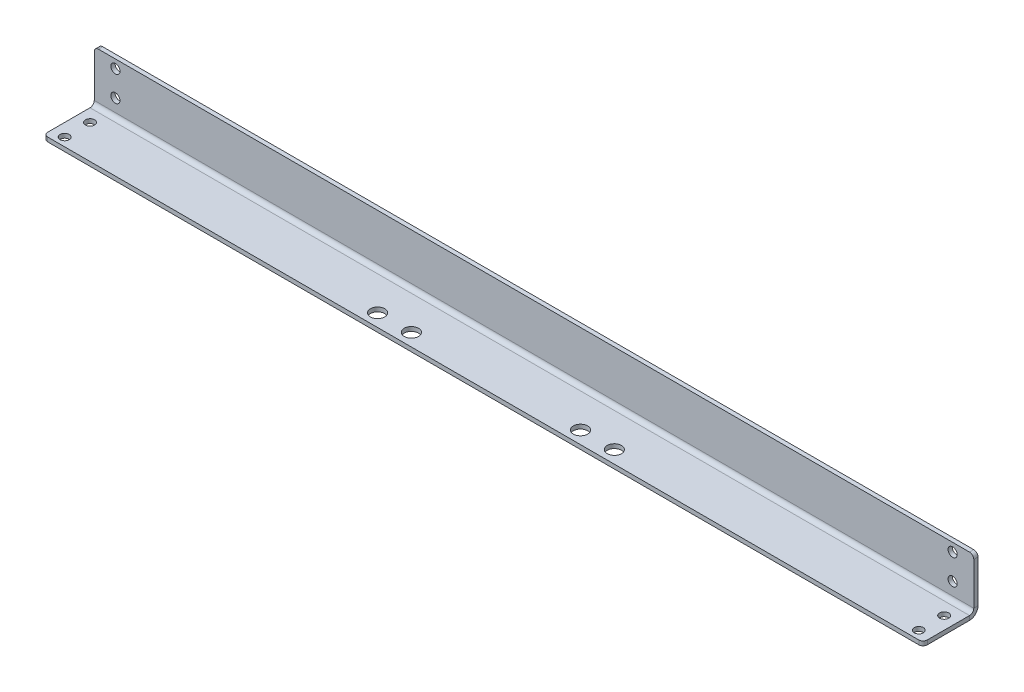
from build123d import *

# Parameters (mm, degrees)
BASE_FLANGE1_DEPTH = 660.4
SKETCH3_R          = 3.429
SKETCH3_R_2        = 5.3578125
CUT_EXTRUDE2_DEPTH = 6.35
FILLET1_R          = 3.175
SKETCH4_R          = 3.429
CUT_EXTRUDE3_DEPTH = 3.175


# Sheet-metal steps are written as plain solids
with BuildPart() as part:
    # Sketch1 → Base-Flange1 (new body)
    with BuildSketch(Plane(origin=(0, 0, 0), x_dir=(0, 0, -1), z_dir=(1, 0, 0))):
        with BuildLine():
            Line((0, 0), (34.925, 0))
            ThreePointArc((34.925, 0), (37.17006403, 0.92993597), (38.1, 3.175))
            Line((38.1, 3.175), (38.1, 38.1))
            Line((38.1, 38.1), (41.275, 38.1))
            Line((41.275, 38.1), (41.275, 3.175))
            ThreePointArc((41.275, 3.175), (39.415128061, -1.315128061), (34.925, -3.175))
            Line((34.925, -3.175), (0, -3.175))
            Line((0, -3.175), (0, 0))
        make_face()
    extrude(amount=BASE_FLANGE1_DEPTH)

    # Sketch3 → Cut-Extrude2 (cut)
    with BuildSketch(Plane.XZ.offset(3.175)):
        with Locations(Location((9.525, -25.4, 0), (0, 0, 270))):
            Circle(SKETCH3_R)
        with Locations(Location((9.525, -6.35, 0), (0, 0, 270))):
            Circle(SKETCH3_R)
        with Locations(Location((650.875, -25.4, 0), (0, 0, 270))):
            Circle(SKETCH3_R)
        with Locations(Location((650.875, -6.35, 0), (0, 0, 270))):
            Circle(SKETCH3_R)
        with Locations(Location((241.3, -9.525, 0), (0, 0, 270))):
            Circle(SKETCH3_R_2)
        with Locations(Location((419.1, -9.525, 0), (0, 0, 270))):
            Circle(SKETCH3_R_2)
        with Locations(Location((266.7, -9.525, 0), (0, 0, 270))):
            Circle(SKETCH3_R_2)
        with Locations(Location((393.7, -9.525, 0), (0, 0, 270))):
            Circle(SKETCH3_R_2)
    extrude(amount=-CUT_EXTRUDE2_DEPTH, mode=Mode.SUBTRACT)

    # Fillet1
    fillet1_edges = [part.edges().sort_by_distance(p)[0] for p in [
        (660.4, -1.5875, 0),
        (0, -1.5875, 0),
        (660.4, 38.1, -39.6875),
        (0, 38.1, -39.6875),
    ]]
    fillet(fillet1_edges, radius=FILLET1_R)

    # Sketch4 → Cut-Extrude3 (cut)
    with BuildSketch(Plane(origin=(0, 0, -41.275), x_dir=(-1, 0, 0), z_dir=(0, 0, -1))):
        with Locations((-644.525, 31.75)):
            Circle(SKETCH4_R)
        with Locations((-644.525, 12.7)):
            Circle(SKETCH4_R)
        with Locations((-15.875, 31.75)):
            Circle(SKETCH4_R)
        with Locations((-15.875, 12.7)):
            Circle(SKETCH4_R)
    extrude(amount=-CUT_EXTRUDE3_DEPTH, mode=Mode.SUBTRACT)


solid = part.part
